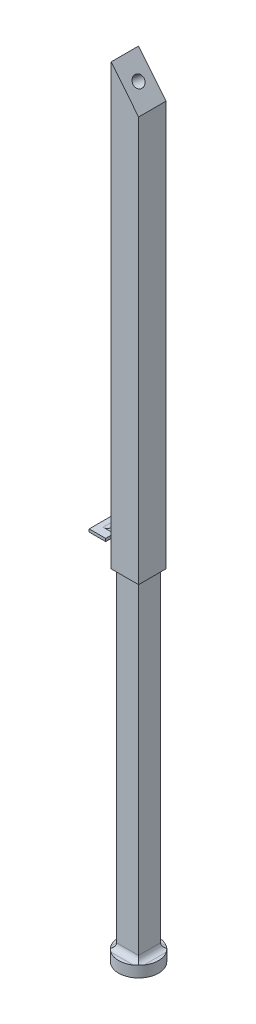
from build123d import *

# Parameters (mm, degrees)
IZIM1_W                     = 25
IZIM1_H                     = 25
Y_KSEKLIK_EKSTR_ZYON1_DEPTH = 400
IZIM2_W                     = 20
IZIM2_H                     = 20
Y_KSEKLIK_EKSTR_ZYON2_DEPTH = 300
IZIM3_R                     = 5
Y_KSEKLIK_EKSTR_ZYON3_DEPTH = 5
IZIM4_W                     = 25
IZIM4_H                     = 2.554442859
Y_KSEKLIK_EKSTR_ZYON4_DEPTH = 15
RADYUS1_R                   = 10
IZIM6_R                     = 18.171292503
Y_KSEKLIK_EKSTR_ZYON5_DEPTH = 10
RADYUS2_R                   = 5
KES_EKSTR_ZYON2_DEPTH       = 58
IZIM8_R                     = 5
KES_EKSTR_ZYON3_DEPTH       = 32


with BuildPart() as part:
    # Çizim1 → Yükseklik-Ekstrüzyon1 (new body)
    with BuildSketch(Plane(origin=(0, 0, 0), x_dir=(1, 0, 0), z_dir=(0, 1, 0))):
        Rectangle(IZIM1_W, IZIM1_H)
    extrude(amount=Y_KSEKLIK_EKSTR_ZYON1_DEPTH)

    # Çizim2 → Yükseklik-Ekstrüzyon2 (add)
    with BuildSketch(Plane.XZ):
        Rectangle(IZIM2_W, IZIM2_H)
    extrude(amount=Y_KSEKLIK_EKSTR_ZYON2_DEPTH)

    # Çizim3 → Yükseklik-Ekstrüzyon3 (add)
    with BuildSketch(Plane.ZY.offset(12.5)):
        with Locations(Location((0, 20.234922869, 0), (0, 0, 180))):
            Circle(IZIM3_R)
    extrude(amount=Y_KSEKLIK_EKSTR_ZYON3_DEPTH)

    # Çizim4 → Yükseklik-Ekstrüzyon4 (add)
    with BuildSketch(Plane.ZY.offset(17.5)):
        with Locations((0, 20.23492287)):
            Rectangle(IZIM4_W, IZIM4_H)
    extrude(amount=Y_KSEKLIK_EKSTR_ZYON4_DEPTH)

    # Radyus1
    # the kernel refuses this fillet: 10 mm, written as the material it adds along each edge
    with BuildSketch(Plane(origin=(-17.5, 18.95770144, -29.834118888), x_dir=(0, -1, 0), z_dir=(0, 0, 1))) as radyus1_piece_1_section:
        with BuildLine():
            CenterArc((RADYUS1_R, -RADYUS1_R), RADYUS1_R, 90, 90)
            Line((0, -RADYUS1_R), (0, 0))
            Line((0, 0), (RADYUS1_R, 0))
        make_face()
    radyus1_piece_1 = extrude(amount=59.668237775, mode=Mode.PRIVATE)
    radyus1_piece_1 = radyus1_piece_1 & Plane(origin=(-20.338214919, 20.234922869, 0), x_dir=(0, 0, -1), z_dir=(1, 0, 0)) * Cylinder(5, 160, mode=Mode.PRIVATE)
    add(radyus1_piece_1)
    with BuildSketch(Plane(origin=(-17.5, 21.512144299, 29.834118888), x_dir=(0, 1, 0), z_dir=(0, 0, -1))) as radyus1_piece_2_section:
        with BuildLine():
            CenterArc((RADYUS1_R, -RADYUS1_R), RADYUS1_R, 90, 90)
            Line((0, -RADYUS1_R), (0, 0))
            Line((0, 0), (RADYUS1_R, 0))
        make_face()
    radyus1_piece_2 = extrude(amount=59.668237775, mode=Mode.PRIVATE)
    radyus1_piece_2 = radyus1_piece_2 & Plane(origin=(-20.33821492, 20.234922869, 0), x_dir=(0, 0, -1), z_dir=(1, 0, 0)) * Cylinder(5, 160, mode=Mode.PRIVATE)
    add(radyus1_piece_2)

    # Çizim6 → Yükseklik-Ekstrüzyon5 (add)
    with BuildSketch(Plane.XZ.offset(300)):
        with Locations(Location((0, 0, 0), (0, 0, 270))):
            Circle(IZIM6_R)
    extrude(amount=Y_KSEKLIK_EKSTR_ZYON5_DEPTH)

    # Radyus2
    # the kernel refuses this fillet: 5 mm, written as the material it adds along each edge
    with BuildSketch(Plane(origin=(10, -300, 10), x_dir=(1, 0, 0), z_dir=(0, 0, -1)), Plane(origin=(-10, -300, 10), x_dir=(0, 0, 1), z_dir=(1, 0, 0)), Plane(origin=(-10, -300, -10), x_dir=(-1, 0, 0), z_dir=(0, 0, 1)), Plane(origin=(10, -300, -10), x_dir=(0, 0, -1), z_dir=(-1, 0, 0))) as radyus2_piece_1:
        with BuildLine():
            CenterArc((RADYUS2_R, -RADYUS2_R), RADYUS2_R, 90, 90)
            Line((0, -RADYUS2_R), (0, 0))
            Line((0, 0), (RADYUS2_R, 0))
        make_face()
    extrude(amount=20)
    with BuildSketch(Plane(origin=(10, -300, 22.5), x_dir=(1, 0, 0), z_dir=(0, 0, -1))) as radyus2_piece_2a_section:
        with BuildLine():
            CenterArc((RADYUS2_R, -RADYUS2_R), RADYUS2_R, 90, 90)
            Line((0, -RADYUS2_R), (0, 0))
            Line((0, 0), (RADYUS2_R, 0))
        make_face()
    radyus2_piece_2a = extrude(amount=32.5, mode=Mode.PRIVATE)
    radyus2_piece_2a = radyus2_piece_2a & Plane(origin=(0, -298.735965494, 0), x_dir=(0, 0, -1), z_dir=(0, 1, 0)) * Cylinder(18.171292503, 85, mode=Mode.PRIVATE)
    radyus2_piece_2a = split(radyus2_piece_2a, bisect_by=Plane(origin=(10.899012229, -298.735965494, 10), z_dir=(0, 0, 1)), keep=Keep.TOP, mode=Mode.PRIVATE)
    with BuildSketch(Plane(origin=(-10, -300, 10), x_dir=(0, 0, 1), z_dir=(1, 0, 0))) as radyus2_piece_2b_section:
        with BuildLine():
            CenterArc((RADYUS2_R, -RADYUS2_R), RADYUS2_R, 90, 90)
            Line((0, -RADYUS2_R), (0, 0))
            Line((0, 0), (RADYUS2_R, 0))
        make_face()
    radyus2_piece_2b = extrude(amount=32.5, mode=Mode.PRIVATE)
    radyus2_piece_2b = radyus2_piece_2b & Plane(origin=(0, -298.73596552, 0), x_dir=(0, 0, -1), z_dir=(0, 1, 0)) * Cylinder(18.171292503, 85, mode=Mode.PRIVATE)
    radyus2_piece_2b = split(radyus2_piece_2b, bisect_by=Plane(origin=(10, -298.73596552, 10.899011766), z_dir=(1, 0, 0)), keep=Keep.TOP, mode=Mode.PRIVATE)
    radyus2_piece_2 = radyus2_piece_2a & radyus2_piece_2b
    add(radyus2_piece_2)
    with BuildSketch(Plane(origin=(22.5, -300, -10), x_dir=(0, 0, -1), z_dir=(-1, 0, 0))) as radyus2_piece_3a_section:
        with BuildLine():
            CenterArc((RADYUS2_R, -RADYUS2_R), RADYUS2_R, 90, 90)
            Line((0, -RADYUS2_R), (0, 0))
            Line((0, 0), (RADYUS2_R, 0))
        make_face()
    radyus2_piece_3a = extrude(amount=32.5, mode=Mode.PRIVATE)
    radyus2_piece_3a = radyus2_piece_3a & Plane(origin=(0, -298.735965494, 0), x_dir=(0, 0, -1), z_dir=(0, 1, 0)) * Cylinder(18.171292503, 85, mode=Mode.PRIVATE)
    radyus2_piece_3a = split(radyus2_piece_3a, bisect_by=Plane(origin=(10, -298.735965494, -10.899012229), z_dir=(1, 0, 0)), keep=Keep.TOP, mode=Mode.PRIVATE)
    with BuildSketch(Plane(origin=(10, -300, 10), x_dir=(1, 0, 0), z_dir=(0, 0, -1))) as radyus2_piece_3b_section:
        with BuildLine():
            CenterArc((RADYUS2_R, -RADYUS2_R), RADYUS2_R, 90, 90)
            Line((0, -RADYUS2_R), (0, 0))
            Line((0, 0), (RADYUS2_R, 0))
        make_face()
    radyus2_piece_3b = extrude(amount=32.5, mode=Mode.PRIVATE)
    radyus2_piece_3b = radyus2_piece_3b & Plane(origin=(0, -298.73596552, 0), x_dir=(0, 0, -1), z_dir=(0, 1, 0)) * Cylinder(18.171292503, 85, mode=Mode.PRIVATE)
    radyus2_piece_3b = split(radyus2_piece_3b, bisect_by=Plane(origin=(10.899011766, -298.73596552, -10), z_dir=(0, 0, -1)), keep=Keep.TOP, mode=Mode.PRIVATE)
    radyus2_piece_3 = radyus2_piece_3a & radyus2_piece_3b
    add(radyus2_piece_3)
    with BuildSketch(Plane(origin=(-22.5, -300, 10), x_dir=(0, 0, 1), z_dir=(1, 0, 0))) as radyus2_piece_4a_section:
        with BuildLine():
            CenterArc((RADYUS2_R, -RADYUS2_R), RADYUS2_R, 90, 90)
            Line((0, -RADYUS2_R), (0, 0))
            Line((0, 0), (RADYUS2_R, 0))
        make_face()
    radyus2_piece_4a = extrude(amount=32.5, mode=Mode.PRIVATE)
    radyus2_piece_4a = radyus2_piece_4a & Plane(origin=(0, -298.735965494, 0), x_dir=(0, 0, -1), z_dir=(0, 1, 0)) * Cylinder(18.171292503, 85, mode=Mode.PRIVATE)
    radyus2_piece_4a = split(radyus2_piece_4a, bisect_by=Plane(origin=(-10, -298.735965494, 10.899012229), z_dir=(-1, 0, 0)), keep=Keep.TOP, mode=Mode.PRIVATE)
    with BuildSketch(Plane(origin=(-10, -300, -10), x_dir=(-1, 0, 0), z_dir=(0, 0, 1))) as radyus2_piece_4b_section:
        with BuildLine():
            CenterArc((RADYUS2_R, -RADYUS2_R), RADYUS2_R, 90, 90)
            Line((0, -RADYUS2_R), (0, 0))
            Line((0, 0), (RADYUS2_R, 0))
        make_face()
    radyus2_piece_4b = extrude(amount=32.5, mode=Mode.PRIVATE)
    radyus2_piece_4b = radyus2_piece_4b & Plane(origin=(0, -298.73596552, 0), x_dir=(0, 0, -1), z_dir=(0, 1, 0)) * Cylinder(18.171292503, 85, mode=Mode.PRIVATE)
    radyus2_piece_4b = split(radyus2_piece_4b, bisect_by=Plane(origin=(-10.899011766, -298.73596552, 10), z_dir=(0, 0, 1)), keep=Keep.TOP, mode=Mode.PRIVATE)
    radyus2_piece_4 = radyus2_piece_4a & radyus2_piece_4b
    add(radyus2_piece_4)
    with BuildSketch(Plane(origin=(10, -300, -10), x_dir=(0, 0, -1), z_dir=(-1, 0, 0))) as radyus2_piece_5a_section:
        with BuildLine():
            CenterArc((RADYUS2_R, -RADYUS2_R), RADYUS2_R, 90, 90)
            Line((0, -RADYUS2_R), (0, 0))
            Line((0, 0), (RADYUS2_R, 0))
        make_face()
    radyus2_piece_5a = extrude(amount=32.5, mode=Mode.PRIVATE)
    radyus2_piece_5a = radyus2_piece_5a & Plane(origin=(0, -298.73596552, 0), x_dir=(0, 0, -1), z_dir=(0, 1, 0)) * Cylinder(18.171292503, 86, mode=Mode.PRIVATE)
    radyus2_piece_5a = split(radyus2_piece_5a, bisect_by=Plane(origin=(-10, -298.73596552, -10.899011766), z_dir=(-1, 0, 0)), keep=Keep.TOP, mode=Mode.PRIVATE)
    with BuildSketch(Plane(origin=(-10, -300, -22.5), x_dir=(-1, 0, 0), z_dir=(0, 0, 1))) as radyus2_piece_5b_section:
        with BuildLine():
            CenterArc((RADYUS2_R, -RADYUS2_R), RADYUS2_R, 90, 90)
            Line((0, -RADYUS2_R), (0, 0))
            Line((0, 0), (RADYUS2_R, 0))
        make_face()
    radyus2_piece_5b = extrude(amount=32.5, mode=Mode.PRIVATE)
    radyus2_piece_5b = radyus2_piece_5b & Plane(origin=(0, -298.735965494, 0), x_dir=(0, 0, -1), z_dir=(0, 1, 0)) * Cylinder(18.171292503, 85, mode=Mode.PRIVATE)
    radyus2_piece_5b = split(radyus2_piece_5b, bisect_by=Plane(origin=(-10.899012229, -298.735965494, -10), z_dir=(0, 0, -1)), keep=Keep.TOP, mode=Mode.PRIVATE)
    radyus2_piece_5 = radyus2_piece_5a & radyus2_piece_5b
    add(radyus2_piece_5)

    # Çizim7 → Kes-Ekstrüzyon2 (cut)
    with BuildSketch(Plane(origin=(0, 0, -12.5), x_dir=(-1, 0, 0), z_dir=(0, 0, -1))):
        Polygon((12.5, 400), (-29.263602087, 348.205056807), (-29.263602087, 417.124411345), (12.5, 417.124411345), align=None)
    extrude(amount=-KES_EKSTR_ZYON2_DEPTH, mode=Mode.SUBTRACT)

    # Çizim8 → Kes-Ekstrüzyon3 (cut)
    with BuildSketch(Plane(origin=(187.878801042, 151.491535729, 0), x_dir=(0, 0, -1), z_dir=(0.7784608732437974, 0.6276931326918469, 0))):
        with Locations(Location((0, 299.402134432, 0), (0, 0, 90))):
            Circle(IZIM8_R)
    extrude(amount=-KES_EKSTR_ZYON3_DEPTH, mode=Mode.SUBTRACT)


solid = part.part
